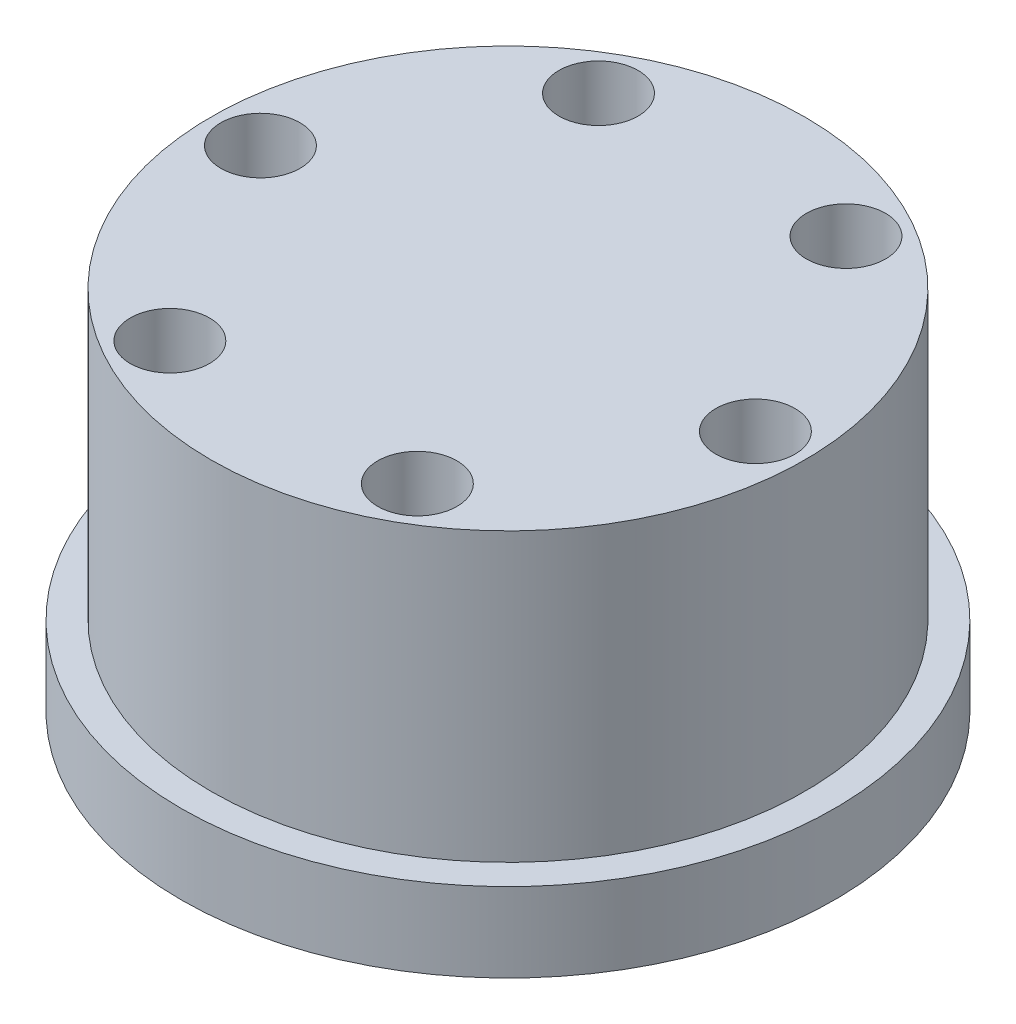
from build123d import *

# Parameters (mm, degrees)
SKETCH1_R           = 16.5
SKETCH1_R_2         = 1.5
BOSS_EXTRUDE1_DEPTH = 4
SKETCH2_R           = 15
BOSS_EXTRUDE2_DEPTH = 14.5
SKETCH3_R           = 9
CUT_EXTRUDE1_DEPTH  = 2
SKETCH4_R           = 6.6
CUT_EXTRUDE2_DEPTH  = 4
SKETCH5_R           = 2
CUT_EXTRUDE3_DEPTH  = 6.5


with BuildPart() as part:
    # Sketch1 → Boss-Extrude1 (new body)
    with BuildSketch(Plane(origin=(0, 0, 0), x_dir=(1, 0, 0), z_dir=(0, 1, 0))):
        Circle(SKETCH1_R)
        with Locations((0, 12.5)):
            Circle(SKETCH1_R_2, mode=Mode.SUBTRACT)
        with Locations((10.825317547, 6.25)):
            Circle(SKETCH1_R_2, mode=Mode.SUBTRACT)
        with Locations((10.825317547, -6.25)):
            Circle(SKETCH1_R_2, mode=Mode.SUBTRACT)
        with Locations((0, -12.5)):
            Circle(SKETCH1_R_2, mode=Mode.SUBTRACT)
        with Locations((-10.825317547, -6.25)):
            Circle(SKETCH1_R_2, mode=Mode.SUBTRACT)
        with Locations((-10.825317547, 6.25)):
            Circle(SKETCH1_R_2, mode=Mode.SUBTRACT)
    extrude(amount=BOSS_EXTRUDE1_DEPTH)

    # Sketch2 → Boss-Extrude2 (add)
    with BuildSketch(Plane(origin=(0, 4, 0), x_dir=(1, 0, 0), z_dir=(0, 1, 0))):
        Circle(SKETCH2_R)
    extrude(amount=BOSS_EXTRUDE2_DEPTH)

    # Sketch3 → Cut-Extrude1 (cut)
    with BuildSketch(Plane.XZ):
        Circle(SKETCH3_R)
    extrude(amount=-CUT_EXTRUDE1_DEPTH, mode=Mode.SUBTRACT)

    # Sketch4 → Cut-Extrude2 (cut)
    with BuildSketch(Plane.XZ.offset(-2)):
        Circle(SKETCH4_R)
    extrude(amount=-CUT_EXTRUDE2_DEPTH, mode=Mode.SUBTRACT)

    # Sketch5 → Cut-Extrude3 (cut)
    with BuildSketch(Plane(origin=(0, 18.5, 0), x_dir=(1, 0, 0), z_dir=(0, 1, 0))):
        with Locations((-12.5, 0)):
            Circle(SKETCH5_R)
        with Locations((-6.25, 10.825317547)):
            Circle(SKETCH5_R)
        with Locations((6.25, 10.825317547)):
            Circle(SKETCH5_R)
        with Locations((12.5, 0)):
            Circle(SKETCH5_R)
        with Locations((6.25, -10.825317547)):
            Circle(SKETCH5_R)
        with Locations((-6.25, -10.825317547)):
            Circle(SKETCH5_R)
    extrude(amount=-CUT_EXTRUDE3_DEPTH, mode=Mode.SUBTRACT)


solid = part.part
